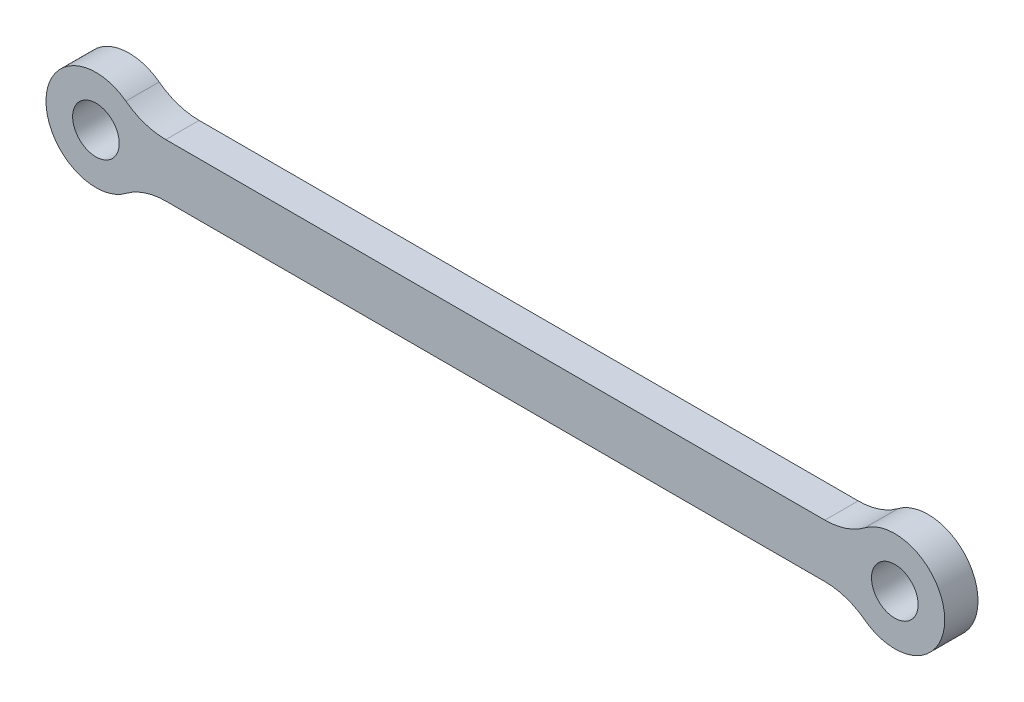
from build123d import *

# Parameters (mm, degrees)
SKETCH1_R          = 3.5
BASE_FLANGE1_DEPTH = 5
FILLET1_R          = 10


# Sheet-metal steps are written as plain solids
with BuildPart() as part:
    # Sketch1 → Base-Flange1 (new body)
    with BuildSketch(Plane.XY):
        with BuildLine():
            Line((-113.65571123, 4), (-6.34428877, 4))
            ThreePointArc((-6.34428877, 4), (7.5, 0), (-6.34428877, -4))
            Line((-6.34428877, -4), (-113.65571123, -4))
            ThreePointArc((-113.65571123, -4), (-127.5, 0), (-113.65571123, 4))
        make_face()
        with Locations((-120, 0)):
            Circle(SKETCH1_R, mode=Mode.SUBTRACT)
        Circle(SKETCH1_R, mode=Mode.SUBTRACT)
    extrude(amount=-BASE_FLANGE1_DEPTH)

    # Fillet1
    fillet1_edges = [part.edges().sort_by_distance(p)[0] for p in [
        (-113.65571123, 4, -2.5),
        (-6.34428877, 4, -2.5),
        (-6.34428877, -4, -2.5),
        (-113.65571123, -4, -2.5),
    ]]
    fillet(fillet1_edges, radius=FILLET1_R)


solid = part.part
